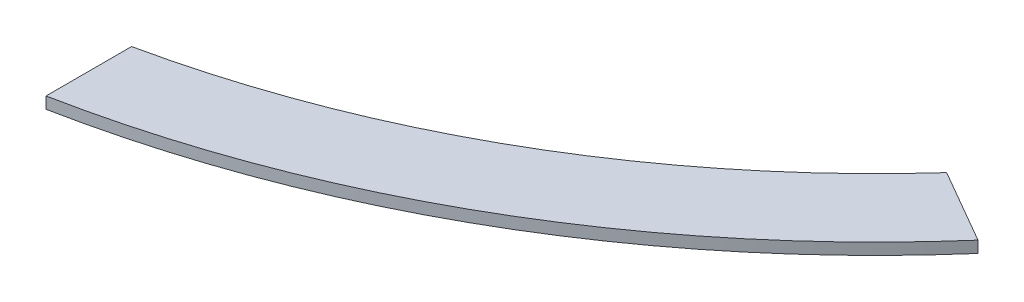
from build123d import *

# Parameters (mm, degrees)
BOSS_EXTRUDE1_DEPTH = 0.762


with BuildPart() as part:
    # Sketch1 → Boss-Extrude1 (new body)
    with BuildSketch(Plane(origin=(0, 0, 0), x_dir=(1, 0, 0), z_dir=(0, 1, 0))):
        with BuildLine():
            ThreePointArc((47.380056013, -42.752819772), (31.90875, -55.267576206), (13.335, -62.408742026))
            Line((13.335, -62.408742026), (13.335, -68.047709285))
            ThreePointArc((13.335, -68.047709285), (34.671, -60.051933549), (52.263544911, -45.572303402))
            Line((52.263544911, -45.572303402), (47.380056013, -42.752819772))
        make_face()
    extrude(amount=BOSS_EXTRUDE1_DEPTH)


solid = part.part
